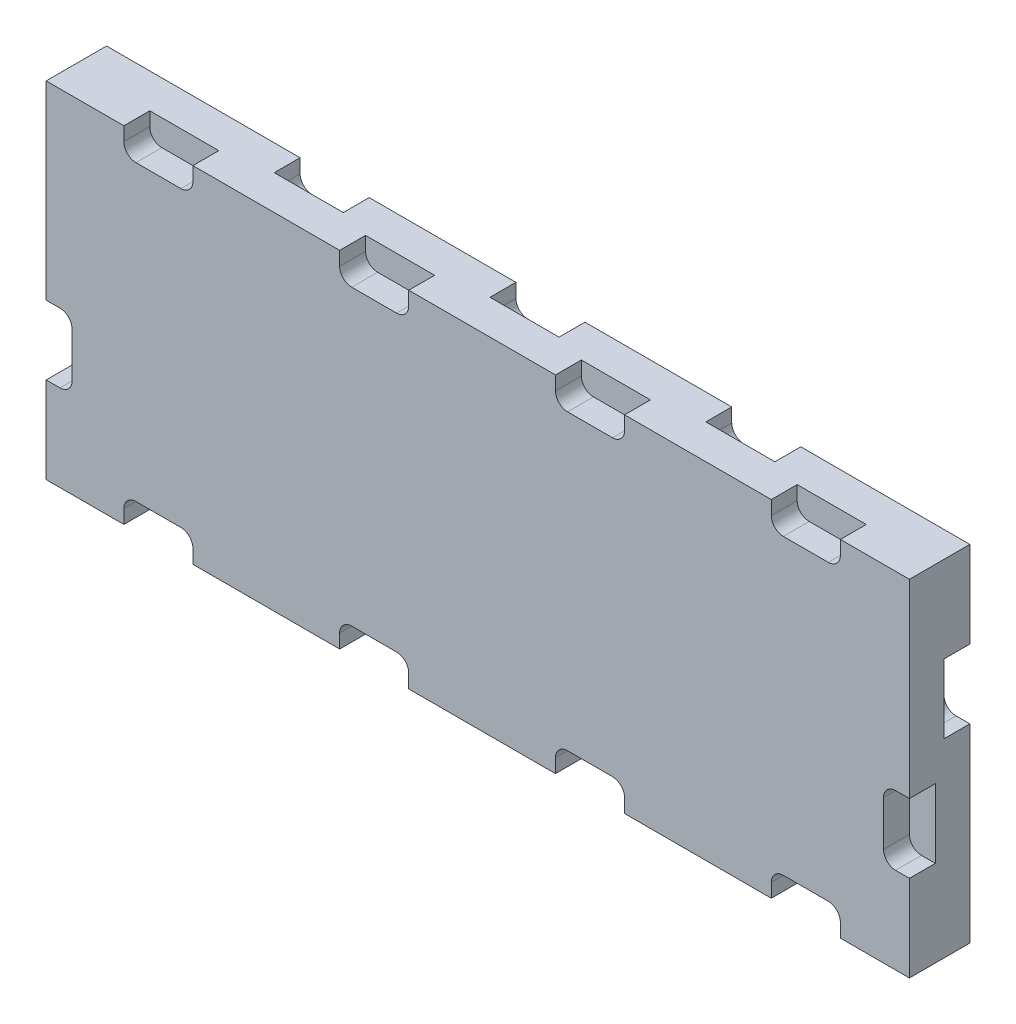
from build123d import *

# Parameters (mm, degrees)
SKETCH1_W           = 500
SKETCH1_H           = 200
BOSS_EXTRUDE1_DEPTH = 35
CUT_EXTRUDE1_DEPTH  = 15
CUT_EXTRUDE2_DEPTH  = 15


with BuildPart() as part:
    # Sketch1 → Boss-Extrude1 (new body)
    with BuildSketch(Plane.XY):
        Rectangle(SKETCH1_W, SKETCH1_H)
    extrude(amount=BOSS_EXTRUDE1_DEPTH)

    # Sketch2 → Cut-Extrude1 (cut)
    with BuildSketch(Plane.XY.offset(35)):
        with BuildLine():
            Line((-205, -100), (-165, -100))
            Line((-165, -100), (-165, -92))
            ThreePointArc((-165, -92), (-167.050252532, -87.050252532), (-172, -85))
            Line((-172, -85), (-198, -85))
            ThreePointArc((-198, -85), (-202.949747468, -87.050252532), (-205, -92))
            Line((-205, -92), (-205, -100))
        make_face()
        with BuildLine():
            Line((-198, 85), (-172, 85))
            ThreePointArc((-172, 85), (-167.050252532, 87.050252532), (-165, 92))
            Line((-165, 92), (-165, 100))
            Line((-165, 100), (-205, 100))
            Line((-205, 100), (-205, 92))
            ThreePointArc((-205, 92), (-202.949747468, 87.050252532), (-198, 85))
        make_face()
        with BuildLine():
            Line((-80, -100), (-80, -92))
            ThreePointArc((-80, -92), (-77.949747468, -87.050252532), (-73, -85))
            Line((-73, -85), (-47, -85))
            ThreePointArc((-47, -85), (-42.050252532, -87.050252532), (-40, -92))
            Line((-40, -92), (-40, -100))
            Line((-40, -100), (-80, -100))
        make_face()
        with BuildLine():
            Line((-73, 85), (-47, 85))
            ThreePointArc((-47, 85), (-42.050252532, 87.050252532), (-40, 92))
            Line((-40, 92), (-40, 100))
            Line((-40, 100), (-80, 100))
            Line((-80, 100), (-80, 92))
            ThreePointArc((-80, 92), (-77.949747468, 87.050252532), (-73, 85))
        make_face()
        with BuildLine():
            Line((45, -100), (45, -92))
            ThreePointArc((45, -92), (47.050252532, -87.050252532), (52, -85))
            Line((52, -85), (78, -85))
            ThreePointArc((78, -85), (82.949747468, -87.050252532), (85, -92))
            Line((85, -92), (85, -100))
            Line((85, -100), (45, -100))
        make_face()
        with BuildLine():
            Line((52, 85), (78, 85))
            ThreePointArc((78, 85), (82.949747468, 87.050252532), (85, 92))
            Line((85, 92), (85, 100))
            Line((85, 100), (45, 100))
            Line((45, 100), (45, 92))
            ThreePointArc((45, 92), (47.050252532, 87.050252532), (52, 85))
        make_face()
        with BuildLine():
            Line((170, -100), (170, -92))
            ThreePointArc((170, -92), (172.050252532, -87.050252532), (177, -85))
            Line((177, -85), (203, -85))
            ThreePointArc((203, -85), (207.949747468, -87.050252532), (210, -92))
            Line((210, -92), (210, -100))
            Line((210, -100), (170, -100))
        make_face()
        with BuildLine():
            Line((177, 85), (203, 85))
            ThreePointArc((203, 85), (207.949747468, 87.050252532), (210, 92))
            Line((210, 92), (210, 100))
            Line((210, 100), (170, 100))
            Line((170, 100), (170, 92))
            ThreePointArc((170, 92), (172.050252532, 87.050252532), (177, 85))
        make_face()
        with BuildLine():
            Line((-250, -50), (-242, -50))
            ThreePointArc((-242, -50), (-237.050252532, -47.949747468), (-235, -43))
            Line((-235, -43), (-235, -17))
            ThreePointArc((-235, -17), (-237.050252532, -12.050252532), (-242, -10))
            Line((-242, -10), (-250, -10))
            Line((-250, -10), (-250, -50))
        make_face()
        with BuildLine():
            Line((250, -10), (242, -10))
            ThreePointArc((242, -10), (237.050252532, -12.050252532), (235, -17))
            Line((235, -17), (235, -43))
            ThreePointArc((235, -43), (237.050252532, -47.949747468), (242, -50))
            Line((242, -50), (250, -50))
            Line((250, -50), (250, -10))
        make_face()
    extrude(amount=-CUT_EXTRUDE1_DEPTH, mode=Mode.SUBTRACT)

    # Sketch3 → Cut-Extrude2 (cut)
    with BuildSketch(Plane(origin=(0, 0, 0), x_dir=(-1, 0, 0), z_dir=(0, 0, -1))):
        with BuildLine():
            Line((137.910849307, -100), (97.910849307, -100))
            Line((97.910849307, -100), (97.910849307, -92))
            ThreePointArc((97.910849307, -92), (99.961101839, -87.050252532), (104.910849307, -85))
            Line((104.910849307, -85), (130.910849307, -85))
            ThreePointArc((130.910849307, -85), (135.860596775, -87.050252532), (137.910849307, -92))
            Line((137.910849307, -92), (137.910849307, -100))
        make_face()
        with BuildLine():
            Line((130.910849307, 85), (104.910849307, 85))
            ThreePointArc((104.910849307, 85), (99.961101839, 87.050252532), (97.910849307, 92))
            Line((97.910849307, 92), (97.910849307, 100))
            Line((97.910849307, 100), (137.910849307, 100))
            Line((137.910849307, 100), (137.910849307, 92))
            ThreePointArc((137.910849307, 92), (135.860596775, 87.050252532), (130.910849307, 85))
        make_face()
        with BuildLine():
            Line((12.910849307, -100), (12.910849307, -92))
            ThreePointArc((12.910849307, -92), (10.860596775, -87.050252532), (5.910849307, -85))
            Line((5.910849307, -85), (-20.089150693, -85))
            ThreePointArc((-20.089150693, -85), (-25.038898161, -87.050252532), (-27.089150693, -92))
            Line((-27.089150693, -92), (-27.089150693, -100))
            Line((-27.089150693, -100), (12.910849307, -100))
        make_face()
        with BuildLine():
            Line((5.910849307, 85), (-20.089150693, 85))
            ThreePointArc((-20.089150693, 85), (-25.038898161, 87.050252532), (-27.089150693, 92))
            Line((-27.089150693, 92), (-27.089150693, 100))
            Line((-27.089150693, 100), (12.910849307, 100))
            Line((12.910849307, 100), (12.910849307, 92))
            ThreePointArc((12.910849307, 92), (10.860596775, 87.050252532), (5.910849307, 85))
        make_face()
        with BuildLine():
            Line((-112.089150693, -100), (-112.089150693, -92))
            ThreePointArc((-112.089150693, -92), (-114.139403225, -87.050252532), (-119.089150693, -85))
            Line((-119.089150693, -85), (-145.089150693, -85))
            ThreePointArc((-145.089150693, -85), (-150.038898161, -87.050252532), (-152.089150693, -92))
            Line((-152.089150693, -92), (-152.089150693, -100))
            Line((-152.089150693, -100), (-112.089150693, -100))
        make_face()
        with BuildLine():
            Line((-119.089150693, 85), (-145.089150693, 85))
            ThreePointArc((-145.089150693, 85), (-150.038898161, 87.050252532), (-152.089150693, 92))
            Line((-152.089150693, 92), (-152.089150693, 100))
            Line((-152.089150693, 100), (-112.089150693, 100))
            Line((-112.089150693, 100), (-112.089150693, 92))
            ThreePointArc((-112.089150693, 92), (-114.139403225, 87.050252532), (-119.089150693, 85))
        make_face()
        with BuildLine():
            Line((250, 50), (242, 50))
            ThreePointArc((242, 50), (237.050252532, 47.949747468), (235, 43))
            Line((235, 43), (235, 17))
            ThreePointArc((235, 17), (237.050252532, 12.050252532), (242, 10))
            Line((242, 10), (250, 10))
            Line((250, 10), (250, 50))
        make_face()
        with BuildLine():
            Line((-250, 10), (-242, 10))
            ThreePointArc((-242, 10), (-237.050252532, 12.050252532), (-235, 17))
            Line((-235, 17), (-235, 43))
            ThreePointArc((-235, 43), (-237.050252532, 47.949747468), (-242, 50))
            Line((-242, 50), (-250, 50))
            Line((-250, 50), (-250, 10))
        make_face()
    extrude(amount=-CUT_EXTRUDE2_DEPTH, mode=Mode.SUBTRACT)


solid = part.part
